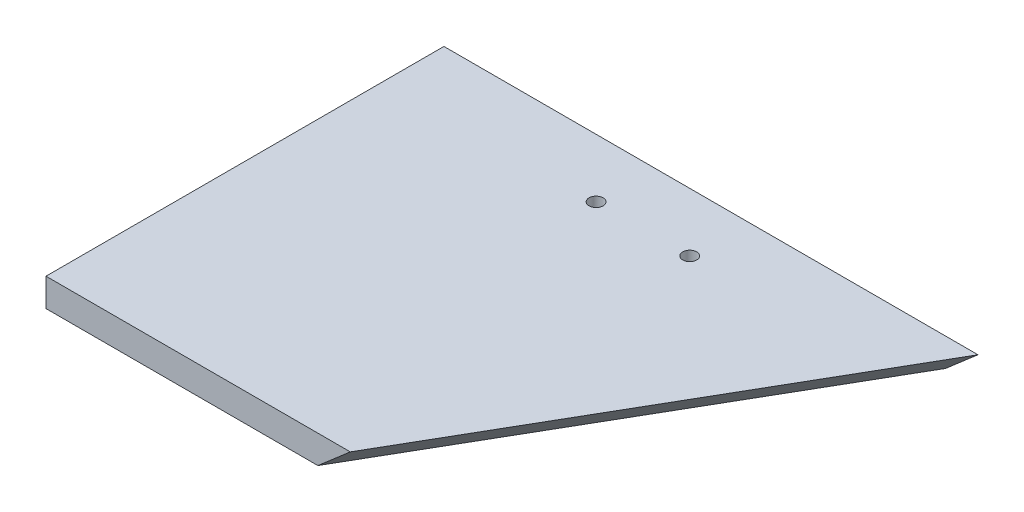
from build123d import *

# Parameters (mm, degrees)
BOSS_EXTRUDE1_DEPTH = 6
SKETCH2_R           = 1.5
CUT_EXTRUDE1_DEPTH  = 108.172757733
CHAMFER1_SIZE       = 6


with BuildPart() as part:
    # Sketch1 → Boss-Extrude1 (new body)
    with BuildSketch(Plane(origin=(0, 0, 0), x_dir=(1, 0, 0), z_dir=(0, 1, 0))):
        Polygon((0, 0), (49.074772881, 85), (0, 85), (-65, 85), (-65, 0), align=None)
    extrude(amount=BOSS_EXTRUDE1_DEPTH)

    # Sketch2 → Cut-Extrude1 (cut, through all)
    with BuildSketch(Plane(origin=(0, 6, 0), x_dir=(1, 0, 0), z_dir=(0, 1, 0))):
        with Locations(Location((-20, 72.5, 0), (0, 0, 270))):
            Circle(SKETCH2_R)
        with Locations(Location((0, 72.5, 0), (0, 0, 270))):
            Circle(SKETCH2_R)
    extrude(amount=-CUT_EXTRUDE1_DEPTH, mode=Mode.SUBTRACT)

    # Chamfer1
    chamfer1_edges = [part.edges().sort_by_distance(p)[0] for p in [
        (24.537386441, 0, -42.5),
    ]]
    chamfer(chamfer1_edges, length=CHAMFER1_SIZE - 0.0001)  # a hair under: the kernel refuses the full size


solid = part.part
